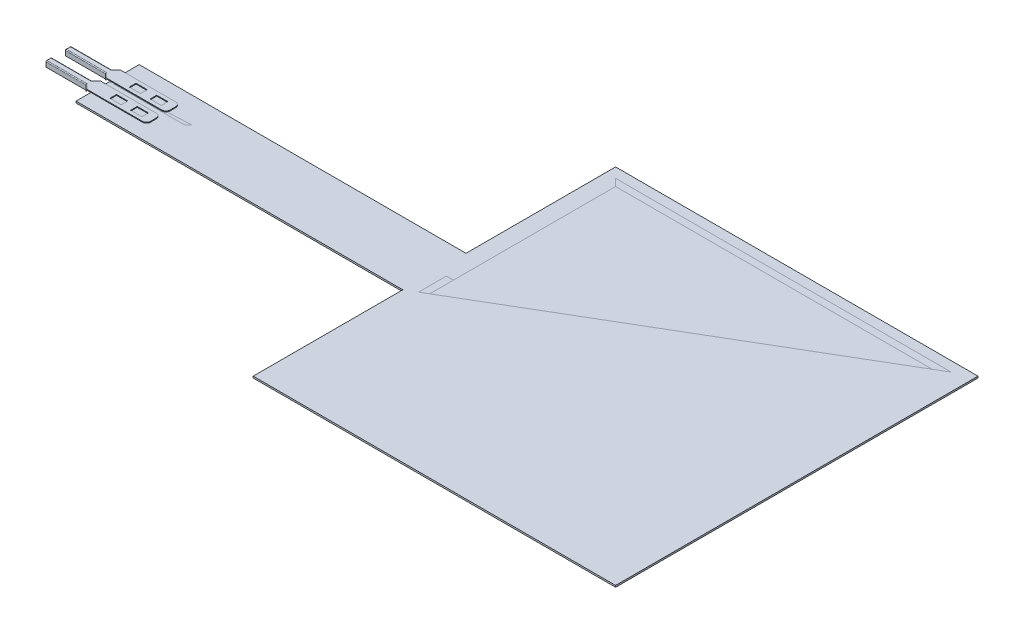
from build123d import *

# Parameters (mm, degrees)
BOSS_EXTRUDE1_DEPTH             = 0.1015
SKETCH4_W                       = 39.6
SKETCH4_H                       = 39.6
BOSS_EXTRUDE2_DEPTH             = 0.1015
BOSS_EXTRUDE4_REACH             = 67.024
SKETCH6_W                       = 41.445
SKETCH6_H                       = 1.85
BOSS_EXTRUDE4_DIRECTION_2_REACH = 67.024
BOSS_EXTRUDE3_REACH             = 67.024
SKETCH5_W                       = 41.3
SKETCH5_H                       = 41.3
SKETCH5_W_2                     = 39.6
SKETCH5_H_2                     = 39.6
BOSS_EXTRUDE3_DIRECTION_2_REACH = 67.024
SKETCH12_W                      = 0.85
SKETCH12_H                      = 1.85
CUT_EXTRUDE2_DEPTH              = 66.024336615
SKETCH12_2_W                    = 0.85
SKETCH12_2_H                    = 1.85
CUT_EXTRUDE7_DEPTH              = 66.024336615
SKETCH14_W                      = 0.85
SKETCH14_H                      = 1.85
CUT_EXTRUDE4_DEPTH              = 66.024336615
SKETCH14_2_W                    = 0.85
SKETCH14_2_H                    = 1.85
CUT_EXTRUDE8_DEPTH              = 66.024336615
BOSS_EXTRUDE5_DEPTH             = 0.1
SKETCH29_W                      = 5
SKETCH29_H                      = 0.7
BOSS_EXTRUDE6_DEPTH             = 0.55
CHAMFER1_SIZE                   = 0.6
CHAMFER2_SIZE                   = 0.6
SKETCH30_W                      = 0.25
SKETCH30_H                      = 0.35
CUT_EXTRUDE_THIN1_DEPTH         = 92.730220087
FILLET2_R                       = 0.1
CHAMFER3_SIZE                   = 0.1
FILLET4_R                       = 0.5
FILLET5_R                       = 0.5
SKETCH31_W                      = 1.35
SKETCH31_H                      = 0.8
CUT_EXTRUDE6_DEPTH              = 0.1
LPATTERN3_COUNT                 = 2
LPATTERN3_PITCH                 = 2.35
SKETCH32_W                      = 5.4
SKETCH32_H                      = 3.81
BOSS_EXTRUDE7_DEPTH             = 0.203
SKETCH33_W                      = 5.4
SKETCH33_H                      = 1.85
CUT_EXTRUDE9_DEPTH              = 71.70569427
SKETCH33_2_W                    = 5.4
SKETCH33_2_H                    = 1.85
CUT_EXTRUDE10_DEPTH             = 71.70569427


with BuildPart() as part:
    # Sketch3 → Boss-Extrude1 (new, symmetric)
    with BuildSketch(Plane(origin=(0, 0, 0), x_dir=(1, 0, 0), z_dir=(0, 1, 0))):
        Polygon((21.845, -21.845), (21.845, 21.845), (-21.845, 21.845), (-21.845, 3.81), (-54.745, 3.81), (-61.245, 3.81), (-61.245, -3.81), (-54.745, -3.81), (-21.845, -3.81), (-21.845, -21.845), align=None)
    extrude(amount=BOSS_EXTRUDE1_DEPTH, both=True)


with BuildPart() as body_2:
    # Sketch4 → Boss-Extrude2 (new, symmetric)
    with BuildSketch(Plane(origin=(0, 0, 0), x_dir=(1, 0, 0), z_dir=(0, 1, 0))):
        Rectangle(SKETCH4_W, SKETCH4_H)
    extrude(amount=BOSS_EXTRUDE2_DEPTH, both=True)


    # Boss-Extrude4: up to this face of the body (flat: up to its plane)
    boss_extrude4_end = Plane(part.part.faces().sort_by_distance((-5.646321076, 0.1015, 0))[0])
    # Sketch6 → Boss-Extrude4 (add, up to the picked face)
    with BuildSketch(Plane(origin=(0, 0, 0), x_dir=(1, 0, 0), z_dir=(0, 1, 0)), mode=Mode.PRIVATE) as boss_extrude4_sk1:
        with Locations((-40.5225, -1.175)):
            Rectangle(SKETCH6_W, SKETCH6_H)
    boss_extrude4_tool1 = split(extrude(boss_extrude4_sk1.sketch, amount=BOSS_EXTRUDE4_REACH, mode=Mode.PRIVATE), bisect_by=boss_extrude4_end, keep=Keep.BOTH, mode=Mode.PRIVATE)
    # Sketch6 → Boss-Extrude4 (add, up to the picked face)
    with BuildSketch(Plane(origin=(0, 0, 0), x_dir=(1, 0, 0), z_dir=(0, 1, 0)), mode=Mode.PRIVATE) as boss_extrude4_sk2:
        with Locations((-40.5225, 1.175)):
            Rectangle(SKETCH6_W, SKETCH6_H)
    boss_extrude4_tool2 = split(extrude(boss_extrude4_sk2.sketch, amount=BOSS_EXTRUDE4_REACH, mode=Mode.PRIVATE), bisect_by=boss_extrude4_end, keep=Keep.BOTH, mode=Mode.PRIVATE)
    add(boss_extrude4_tool1.solids().sort_by(Axis((-40.5225, 0, 1.175), (0, 1, 0)))[0])
    add(boss_extrude4_tool2.solids().sort_by(Axis((-40.5225, 0, -1.175), (0, 1, 0)))[0])


    # Boss-Extrude4 direction 2: up to this face of the body (flat: up to its plane)
    boss_extrude4_direction_2_end = Plane(part.part.faces().sort_by_distance((-5.646321076, -0.1015, 0))[0])
    # Sketch6 → Boss-Extrude4 direction 2 (add, up to the picked face)
    with BuildSketch(Plane(origin=(0, 0, 0), x_dir=(1, 0, 0), z_dir=(0, 1, 0)), mode=Mode.PRIVATE) as boss_extrude4_direction_2_sk1:
        with Locations((-40.5225, -1.175)):
            Rectangle(SKETCH6_W, SKETCH6_H)
    boss_extrude4_direction_2_tool1 = split(extrude(boss_extrude4_direction_2_sk1.sketch, amount=-BOSS_EXTRUDE4_DIRECTION_2_REACH, mode=Mode.PRIVATE), bisect_by=boss_extrude4_direction_2_end, keep=Keep.BOTH, mode=Mode.PRIVATE)
    # Sketch6 → Boss-Extrude4 direction 2 (add, up to the picked face)
    with BuildSketch(Plane(origin=(0, 0, 0), x_dir=(1, 0, 0), z_dir=(0, 1, 0)), mode=Mode.PRIVATE) as boss_extrude4_direction_2_sk2:
        with Locations((-40.5225, 1.175)):
            Rectangle(SKETCH6_W, SKETCH6_H)
    boss_extrude4_direction_2_tool2 = split(extrude(boss_extrude4_direction_2_sk2.sketch, amount=-BOSS_EXTRUDE4_DIRECTION_2_REACH, mode=Mode.PRIVATE), bisect_by=boss_extrude4_direction_2_end, keep=Keep.BOTH, mode=Mode.PRIVATE)
    add(boss_extrude4_direction_2_tool1.solids().sort_by(Axis((-40.5225, 0, 1.175), (0, -1, 0)))[0])
    add(boss_extrude4_direction_2_tool2.solids().sort_by(Axis((-40.5225, 0, -1.175), (0, -1, 0)))[0])

    # Sketch12 → Cut-Extrude2 (cut, through all)
    with BuildSketch(Plane(origin=(0, 0, 0), x_dir=(1, 0, 0), z_dir=(0, 1, 0))):
        with Locations((-20.225, -1.175)):
            Rectangle(SKETCH12_W, SKETCH12_H)
    extrude(amount=CUT_EXTRUDE2_DEPTH, mode=Mode.SUBTRACT)

    # Sketch14<2> → Cut-Extrude8 (cut, through all)
    with BuildSketch(Plane(origin=(0, 0, 0), x_dir=(1, 0, 0), z_dir=(0, 1, 0))):
        with Locations((-20.225, 1.175)):
            Rectangle(SKETCH14_2_W, SKETCH14_2_H)
    extrude(amount=-CUT_EXTRUDE8_DEPTH, mode=Mode.SUBTRACT)

    # Sketch33<2> → Cut-Extrude10 (cut, through all)
    with BuildSketch(Plane(origin=(0, 0, 0), x_dir=(1, 0, 0), z_dir=(0, 1, 0))):
        with Locations((-24.545, -1.175)):
            Rectangle(SKETCH33_2_W, SKETCH33_2_H)
    extrude(amount=CUT_EXTRUDE10_DEPTH, mode=Mode.SUBTRACT)


with BuildPart() as body_3:

    # Boss-Extrude3: up to this face of the body (flat: up to its plane)
    boss_extrude3_end = Plane(part.part.faces().sort_by_distance((-5.646321076, 0.1015, 0))[0])
    # Sketch5 → Boss-Extrude3 (new, up to the picked face)
    with BuildSketch(Plane(origin=(0, 0, 0), x_dir=(1, 0, 0), z_dir=(0, 1, 0)), mode=Mode.PRIVATE) as boss_extrude3_sk1:
        Rectangle(SKETCH5_W, SKETCH5_H)
        Rectangle(SKETCH5_W_2, SKETCH5_H_2, mode=Mode.SUBTRACT)
    boss_extrude3_tool1 = split(extrude(boss_extrude3_sk1.sketch, amount=BOSS_EXTRUDE3_REACH, mode=Mode.PRIVATE), bisect_by=boss_extrude3_end, keep=Keep.BOTH, mode=Mode.PRIVATE)
    add(boss_extrude3_tool1.solids().sort_by(Axis((0, 0, 20.06593), (0, 1, 0)))[0])


    # Boss-Extrude3 direction 2: up to this face of the body (flat: up to its plane)
    boss_extrude3_direction_2_end = Plane(part.part.faces().sort_by_distance((-5.646321076, -0.1015, 0))[0])
    # Sketch5 → Boss-Extrude3 direction 2 (add, up to the picked face)
    with BuildSketch(Plane(origin=(0, 0, 0), x_dir=(1, 0, 0), z_dir=(0, 1, 0)), mode=Mode.PRIVATE) as boss_extrude3_direction_2_sk1:
        Rectangle(SKETCH5_W, SKETCH5_H)
        Rectangle(SKETCH5_W_2, SKETCH5_H_2, mode=Mode.SUBTRACT)
    boss_extrude3_direction_2_tool1 = split(extrude(boss_extrude3_direction_2_sk1.sketch, amount=-BOSS_EXTRUDE3_DIRECTION_2_REACH, mode=Mode.PRIVATE), bisect_by=boss_extrude3_direction_2_end, keep=Keep.BOTH, mode=Mode.PRIVATE)
    add(boss_extrude3_direction_2_tool1.solids().sort_by(Axis((0, 0, 20.06593), (0, -1, 0)))[0])

    # Sketch12<2> → Cut-Extrude7 (cut, through all)
    with BuildSketch(Plane(origin=(0, 0, 0), x_dir=(1, 0, 0), z_dir=(0, 1, 0))):
        with Locations((-20.225, -1.175)):
            Rectangle(SKETCH12_2_W, SKETCH12_2_H)
    extrude(amount=-CUT_EXTRUDE7_DEPTH, mode=Mode.SUBTRACT)

    # Sketch14 → Cut-Extrude4 (cut, through all)
    with BuildSketch(Plane(origin=(0, 0, 0), x_dir=(1, 0, 0), z_dir=(0, 1, 0))):
        with Locations((-20.225, 1.175)):
            Rectangle(SKETCH14_W, SKETCH14_H)
    extrude(amount=CUT_EXTRUDE4_DEPTH, mode=Mode.SUBTRACT)


with BuildPart() as body_4:
    # Sketch28 → Boss-Extrude5 (new body)
    with BuildSketch(Plane(origin=(0, 0.1015, 0), x_dir=(1, 0, 0), z_dir=(0, 1, 0))):
        Polygon((-61.745, 0.335), (-54.545, 0.335), (-54.545, 2.015), (-61.745, 2.015), (-61.745, 1.525), (-67.245, 1.525), (-67.245, 0.825), (-61.745, 0.825), align=None)
    extrude(amount=BOSS_EXTRUDE5_DEPTH)

    # Sketch29 → Boss-Extrude6 (add)
    with BuildSketch(Plane.XZ.offset(-0.1015)):
        with Locations((-64.745, -1.175)):
            Rectangle(SKETCH29_W, SKETCH29_H)
    extrude(amount=BOSS_EXTRUDE6_DEPTH)

    # Chamfer1
    # the kernel refuses this chamfer: 0.6 mm, written as the material it adds along each edge
    with BuildSketch(Plane(origin=(-61.745, -1.441509793, -0.825), x_dir=(-0.9996219169112968, 0, -0.027495876610586265), z_dir=(0, 1, 0))) as chamfer1_piece_1_section:
        Polygon((CHAMFER1_SIZE * 0.999621916911, CHAMFER1_SIZE * 0.0274958766106), (-CHAMFER1_SIZE * 0.0274958766106, CHAMFER1_SIZE * 0.999621916911), (0, 0), align=None)
    chamfer1_piece_1 = extrude(amount=1.643009793, mode=Mode.PRIVATE)
    chamfer1_piece_1 = split(chamfer1_piece_1, bisect_by=Plane(origin=(-62.287471069, 0.1015, -0.807931278), z_dir=(0, -1, 0)), keep=Keep.TOP, mode=Mode.PRIVATE)
    chamfer1_piece_1 = split(chamfer1_piece_1, bisect_by=Plane(origin=(-62.245, -0.1735, -0.807931278), z_dir=(-1, 0, 0)), keep=Keep.TOP, mode=Mode.PRIVATE)
    chamfer1_piece_1 = split(chamfer1_piece_1, bisect_by=Plane(origin=(-62.287471069, -0.4485, -0.807931278), z_dir=(0, 1, 0)), keep=Keep.TOP, mode=Mode.PRIVATE)
    add(chamfer1_piece_1)
    with BuildSketch(Plane(origin=(-61.745, 0.1015, -0.825), x_dir=(-0.9996219169112968, 0, -0.027495876610586265), z_dir=(0, 1, 0))) as chamfer1_piece_2_section:
        Polygon((CHAMFER1_SIZE * 0.999621916911, CHAMFER1_SIZE * 0.0274958766106), (-CHAMFER1_SIZE * 0.0274958766106, CHAMFER1_SIZE * 0.999621916911), (0, 0), align=None)
    chamfer1_piece_2 = extrude(amount=0.1, mode=Mode.PRIVATE)
    chamfer1_piece_2 = split(chamfer1_piece_2, bisect_by=Plane(origin=(-62.245, 0.1515, -0.807931278), z_dir=(-1, 0, 0)), keep=Keep.TOP, mode=Mode.PRIVATE)
    add(chamfer1_piece_2)
    with BuildSketch(Plane(origin=(-61.745, 0.1015, -0.825), x_dir=(-0.9996219169112968, 0, -0.027495876610586265), z_dir=(0, 1, 0))) as chamfer1_piece_3_section:
        Polygon((CHAMFER1_SIZE * 0.999621916911, CHAMFER1_SIZE * 0.0274958766106), (-CHAMFER1_SIZE * 0.0274958766106, CHAMFER1_SIZE * 0.999621916911), (0, 0), align=None)
    chamfer1_piece_3 = extrude(amount=0.1, mode=Mode.PRIVATE)
    chamfer1_piece_3 = split(chamfer1_piece_3, bisect_by=Plane(origin=(-61.936971503, 0.1515, -0.335), z_dir=(0, 0, -1)), keep=Keep.TOP, mode=Mode.PRIVATE)
    chamfer1_piece_3 = split(chamfer1_piece_3, bisect_by=Plane(origin=(-62.245, 0.1515, -0.636152833), z_dir=(1, 0, 0)), keep=Keep.TOP, mode=Mode.PRIVATE)
    add(chamfer1_piece_3)
    with BuildSketch(Plane(origin=(-61.745, -1.441509793, -1.525), x_dir=(-0.9996219169112968, 0, 0.027495876610586265), z_dir=(0, 1, 0))) as chamfer1_piece_4_section:
        Polygon((CHAMFER1_SIZE * 0.999621916911, -CHAMFER1_SIZE * 0.0274958766106), (-CHAMFER1_SIZE * 0.0274958766106, -CHAMFER1_SIZE * 0.999621916911), (0, 0), align=None)
    chamfer1_piece_4 = extrude(amount=1.643009793, mode=Mode.PRIVATE)
    chamfer1_piece_4 = split(chamfer1_piece_4, bisect_by=Plane(origin=(-62.287471069, -0.4485, -1.542068722), z_dir=(0, 1, 0)), keep=Keep.TOP, mode=Mode.PRIVATE)
    chamfer1_piece_4 = split(chamfer1_piece_4, bisect_by=Plane(origin=(-62.245, -0.1735, -1.542068722), z_dir=(-1, 0, 0)), keep=Keep.TOP, mode=Mode.PRIVATE)
    chamfer1_piece_4 = split(chamfer1_piece_4, bisect_by=Plane(origin=(-62.287471069, 0.1015, -1.542068722), z_dir=(0, -1, 0)), keep=Keep.TOP, mode=Mode.PRIVATE)
    add(chamfer1_piece_4)
    with BuildSketch(Plane(origin=(-61.745, 0.1015, -1.525), x_dir=(-0.9996219169112968, 0, 0.027495876610586265), z_dir=(0, 1, 0))) as chamfer1_piece_5_section:
        Polygon((CHAMFER1_SIZE * 0.999621916911, -CHAMFER1_SIZE * 0.0274958766106), (-CHAMFER1_SIZE * 0.0274958766106, -CHAMFER1_SIZE * 0.999621916911), (0, 0), align=None)
    chamfer1_piece_5 = extrude(amount=0.1, mode=Mode.PRIVATE)
    chamfer1_piece_5 = split(chamfer1_piece_5, bisect_by=Plane(origin=(-62.245, 0.1515, -1.542068722), z_dir=(-1, 0, 0)), keep=Keep.TOP, mode=Mode.PRIVATE)
    add(chamfer1_piece_5)
    with BuildSketch(Plane(origin=(-61.745, 0.1015, -1.525), x_dir=(-0.9996219169112968, 0, 0.027495876610586265), z_dir=(0, 1, 0))) as chamfer1_piece_6_section:
        Polygon((CHAMFER1_SIZE * 0.999621916911, -CHAMFER1_SIZE * 0.0274958766106), (-CHAMFER1_SIZE * 0.0274958766106, -CHAMFER1_SIZE * 0.999621916911), (0, 0), align=None)
    chamfer1_piece_6 = extrude(amount=0.1, mode=Mode.PRIVATE)
    chamfer1_piece_6 = split(chamfer1_piece_6, bisect_by=Plane(origin=(-62.245, 0.1515, -1.713847167), z_dir=(1, 0, 0)), keep=Keep.TOP, mode=Mode.PRIVATE)
    chamfer1_piece_6 = split(chamfer1_piece_6, bisect_by=Plane(origin=(-61.936971503, 0.1515, -2.015), z_dir=(0, 0, 1)), keep=Keep.TOP, mode=Mode.PRIVATE)
    add(chamfer1_piece_6)

    # Chamfer2
    # the kernel refuses this chamfer: 0.6 mm, written as the material it adds along each edge
    with BuildSketch(Plane(origin=(-62.245, 0.1015, 0.818009793), x_dir=(-0.027495876610584478, -0.9996219169112968, 0), z_dir=(0, 0, -1))) as chamfer2_piece_1_section:
        Polygon((CHAMFER2_SIZE * 0.999621916911, -CHAMFER2_SIZE * 0.0274958766106), (-CHAMFER2_SIZE * 0.0274958766106, -CHAMFER2_SIZE * 0.999621916911), (0, 0), align=None)
    chamfer2_piece_1 = extrude(amount=3.986019586, mode=Mode.PRIVATE)
    chamfer2_piece_1 = split(chamfer2_piece_1, bisect_by=Plane(origin=(-62.354551126, -0.075864329, -1.515448874), z_dir=(0.7071067811868302, 0, 0.7071067811862649)), keep=Keep.TOP, mode=Mode.PRIVATE)
    chamfer2_piece_1 = split(chamfer2_piece_1, bisect_by=Plane(origin=(-62.014102253, -0.075864329, -2.015), z_dir=(0, 0, 1)), keep=Keep.TOP, mode=Mode.PRIVATE)
    chamfer2_piece_1 = split(chamfer2_piece_1, bisect_by=Plane(origin=(-62.014102253, -0.075864329, -0.335), z_dir=(0, 0, -1)), keep=Keep.TOP, mode=Mode.PRIVATE)
    chamfer2_piece_1 = split(chamfer2_piece_1, bisect_by=Plane(origin=(-62.354551126, -0.075864329, -0.834551126), z_dir=(0.7071067811868302, 0, -0.7071067811862649)), keep=Keep.TOP, mode=Mode.PRIVATE)
    chamfer2_piece_1 = split(chamfer2_piece_1, bisect_by=Plane(origin=(-62.014102253, -0.4485, -1.175), z_dir=(0, 1, 0)), keep=Keep.TOP, mode=Mode.PRIVATE)
    add(chamfer2_piece_1)

    # Sketch30 → Cut-Extrude-Thin1 (cut, through all)
    with BuildSketch(Plane.ZY.offset(67.245)):
        with Locations((-1.175, -0.2735)):
            Rectangle(SKETCH30_W, SKETCH30_H)
    extrude(amount=-CUT_EXTRUDE_THIN1_DEPTH, mode=Mode.SUBTRACT)

    # Fillet2
    fillet2_edges = [body_4.edges().sort_by_distance(p)[0] for p in [
        (-62.1, 0.2015, -1.77),
        (-62.1, 0.2015, -0.58),
        (-64.795, 0.2015, -0.825),
        (-64.795, 0.2015, -1.525),
    ]]
    fillet(fillet2_edges, radius=FILLET2_R)

    # Chamfer3
    chamfer3_edges = [body_4.edges().sort_by_distance(p)[0] for p in [
        (-67.245, 0.2015, -1.175),
        (-67.245, -0.1735, -0.825),
        (-67.245, -0.1735, -1.525),
        (-67.245, 0.172210678, -1.495710678),
        (-67.245, 0.172210678, -0.854289322),
    ]]
    chamfer(chamfer3_edges, length=CHAMFER3_SIZE)

    # Fillet4
    # the kernel refuses this fillet: 0.5 mm, written as the material it takes off along each edge
    with BuildSketch(Plane(origin=(-61.855, 0.619266953, -2.015), x_dir=(1, 0, 0), z_dir=(0, -1, 0))) as fillet4_piece_1:
        with BuildLine():
            CenterArc((FILLET4_R * 0.414213562374, FILLET4_R), FILLET4_R, 225, 45)
            Line((-FILLET4_R * 0.292893218814, FILLET4_R * 0.292893218814), (0, 0))
            Line((0, 0), (FILLET4_R * 0.414213562374, 0))
        make_face()
    extrude(amount=1.245533906, mode=Mode.SUBTRACT)
    with BuildSketch(Plane(origin=(-61.855, 0.619266953, -0.335), x_dir=(1, 0, 0), z_dir=(0, -1, 0))) as fillet4_piece_2:
        with BuildLine():
            CenterArc((FILLET4_R * 0.414213562374, -FILLET4_R), FILLET4_R, 90, 45)
            Line((-FILLET4_R * 0.292893218814, -FILLET4_R * 0.292893218814), (0, 0))
            Line((0, 0), (FILLET4_R * 0.414213562374, 0))
        make_face()
    extrude(amount=1.245533906, mode=Mode.SUBTRACT)

    # Fillet5
    fillet5_edges = [body_4.edges().sort_by_distance(p)[0] for p in [
        (-54.545, 0.1515, -0.335),
        (-54.545, 0.1515, -2.015),
    ]]
    fillet(fillet5_edges, radius=FILLET5_R)

    # Sketch31 → Cut-Extrude6 (cut)
    with BuildSketch(Plane(origin=(0, 0.2015, 0), x_dir=(1, 0, 0), z_dir=(0, 1, 0))):
        with Locations((-56.22, 1.175)):
            Rectangle(SKETCH31_W, SKETCH31_H)
        with Locations((-58.72, 1.175)):
            Rectangle(SKETCH31_W, SKETCH31_H)
    extrude(amount=-CUT_EXTRUDE6_DEPTH, mode=Mode.SUBTRACT)


with BuildPart() as lpattern3_1:
    # LPattern3: pattern copy
    add(body_4.part.moved(Location(Vector(0, 0, 1) * (1 * LPATTERN3_PITCH))))


with BuildPart() as body_6:
    # Sketch32 → Boss-Extrude7 (new body)
    with BuildSketch(Plane(origin=(0, 0.1015, 0), x_dir=(1, 0, 0), z_dir=(0, 1, 0))):
        with Locations((-24.545, -1.905)):
            Rectangle(SKETCH32_W, SKETCH32_H)
    extrude(amount=-BOSS_EXTRUDE7_DEPTH)

    # Sketch33 → Cut-Extrude9 (cut, through all)
    with BuildSketch(Plane(origin=(0, 0, 0), x_dir=(1, 0, 0), z_dir=(0, 1, 0))):
        with Locations((-24.545, -1.175)):
            Rectangle(SKETCH33_W, SKETCH33_H)
    extrude(amount=-CUT_EXTRUDE9_DEPTH, mode=Mode.SUBTRACT)


solid = Compound([part.part, body_2.part, body_3.part, body_4.part, lpattern3_1.part, body_6.part])
